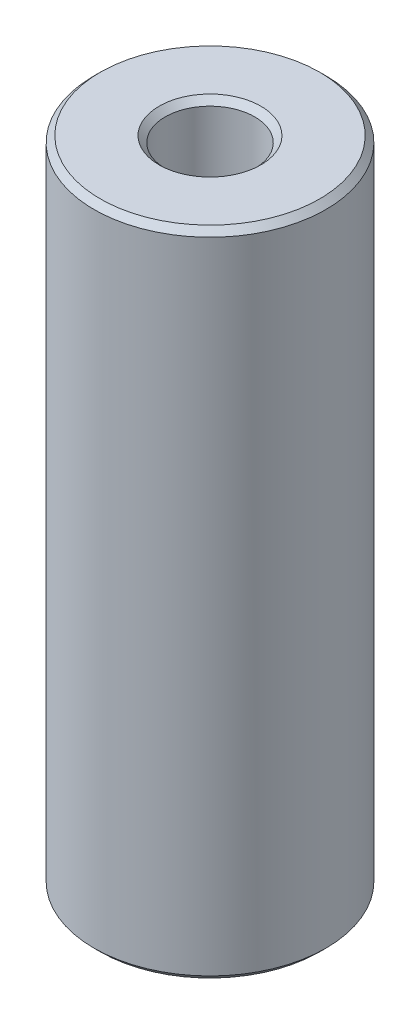
from build123d import *

# Parameters (mm, degrees)
SKETCH1_R           = 55
BOSS_EXTRUDE1_DEPTH = 309.418122975
SKETCH2_R           = 21.236031722
CUT_EXTRUDE1_DEPTH  = 320.044784984
CHAMFER1_SIZE       = 2.919558663


with BuildPart() as part:
    # Sketch1 → Boss-Extrude1 (new body)
    with BuildSketch(Plane(origin=(0, 0, 0), x_dir=(1, 0, 0), z_dir=(0, 1, 0))):
        Circle(SKETCH1_R)
    extrude(amount=BOSS_EXTRUDE1_DEPTH)

    # Sketch2 → Cut-Extrude1 (cut, through all)
    with BuildSketch(Plane(origin=(0, 0, 0), x_dir=(1, 0, 0), z_dir=(0, 1, 0))):
        Circle(SKETCH2_R)
    extrude(amount=CUT_EXTRUDE1_DEPTH, mode=Mode.SUBTRACT)

    # Chamfer1
    chamfer1_edges = [part.edges().sort_by_distance(p)[0] for p in [
        (-21.236031722, 309.418122975, 0),
        (-21.236031722, 0, 0),
        (-55, 0, 0),
        (-55, 309.418122975, 0),
    ]]
    chamfer(chamfer1_edges, length=CHAMFER1_SIZE)


solid = part.part
